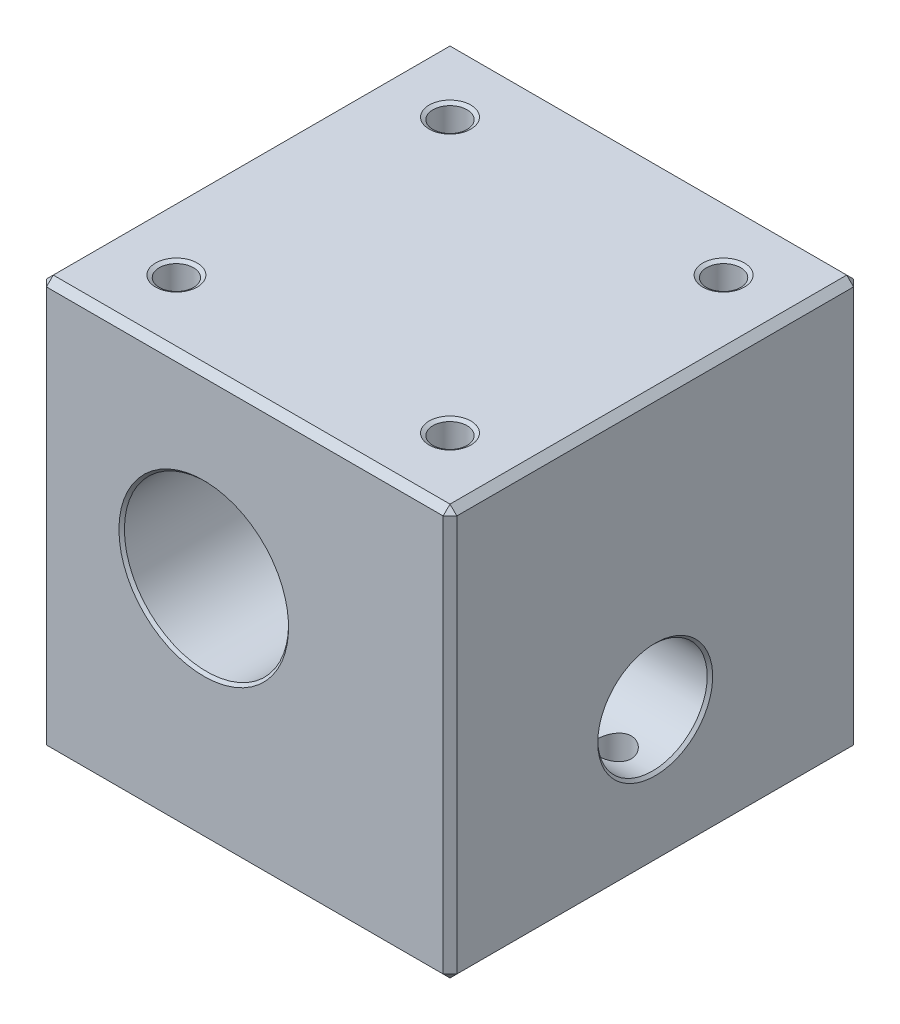
from build123d import *

# Parameters (mm, degrees)
SCHIZZO1_W                      = 30
SCHIZZO1_H                      = 30
SCHIZZO1_R                      = 6
ESTRUSIONE_ESTRUSIONE1_DEPTH    = 30
F_8_0_8_DIAMETER_HOLE1_D        = 8
F_8_0_8_DIAMETER_HOLE1_DEPTH    = 13.5
F_8_0_8_DIAMETER_HOLE1_TIP      = 2.403442476
FORO_FILETTATO_M3_1_AT_2_COUNT  = 2
FORO_FILETTATO_M3_1_AT_2_PITCH  = 20
FORO_FILETTATO_M3_2_D           = 2.5
FORO_FILETTATO_M3_2_DEPTH       = 8.5
FORO_FILETTATO_M3_2_CSINK_D     = 3.05
FORO_FILETTATO_M3_2_CSINK_ANGLE = 120
FORO_FILETTATO_M3_2_TIP         = 0.751075774
CHAMFER1_SIZE                   = 0.5
CHAMFER2_SIZE                   = 0.2


with BuildPart() as part:
    # Schizzo1 → Estrusione-Estrusione1 (new body)
    with BuildSketch(Plane.XY):
        with Locations((15, 15)):
            Rectangle(SCHIZZO1_W, SCHIZZO1_H)
        with Locations((12, 16.8)):
            Circle(SCHIZZO1_R, mode=Mode.SUBTRACT)
    extrude(amount=ESTRUSIONE_ESTRUSIONE1_DEPTH)

    # Ø8.0 (8) Diameter Hole1
    with Locations(Plane(origin=(30, 0, 0), x_dir=(0, 0, -1), z_dir=(1, 0, 0))):
        with Locations((-15, 10)):
            Hole(F_8_0_8_DIAMETER_HOLE1_D / 2, depth=F_8_0_8_DIAMETER_HOLE1_DEPTH)
            with Locations((0, 0, -(F_8_0_8_DIAMETER_HOLE1_DEPTH + F_8_0_8_DIAMETER_HOLE1_TIP / 2))):  # 118° drill point
                Cone(0, F_8_0_8_DIAMETER_HOLE1_D / 2, F_8_0_8_DIAMETER_HOLE1_TIP, mode=Mode.SUBTRACT)

    # Schizzo7 → Foro filettato M3-1 (revolve, cut)
    with BuildSketch(Plane(origin=(5, 30, 25), x_dir=(0, 0, 1), z_dir=(1, 0, 0))):
        Polygon((0, 0), (0, 9.251075774), (1.25, 8.5), (1.25, 0.158771324), (1.525, 0), align=None)
    foro_filettato_m3_1 = revolve(axis=Axis((5, 36.35, 25), (0, -1, 0)), mode=Mode.SUBTRACT)

    # Foro filettato M3-1 at 2: Foro filettato M3-1 ×2
    with Locations(*[(i * FORO_FILETTATO_M3_1_AT_2_PITCH, 0, 0) for i in range(1, FORO_FILETTATO_M3_1_AT_2_COUNT)]):
        add(foro_filettato_m3_1, mode=Mode.SUBTRACT)

    # Specchia1: Foro filettato M3-1 across plane
    add(foro_filettato_m3_1.mirror(Plane.XY.offset(15)), mode=Mode.SUBTRACT)

    # Specchia1 copy 1 sketch → Specchia1 copy 1 (revolve, cut)
    with BuildSketch(Plane(origin=(25, 30, 5), x_dir=(0, 0, -1), z_dir=(1, 0, 0))):
        Polygon((0, 0), (0, -9.251075774), (1.25, -8.5), (1.25, -0.158771324), (1.525, 0), align=None)
    revolve(axis=Axis((25, 36.35, 5), (0, 1, 0)), mode=Mode.SUBTRACT)

    # Foro filettato M3-2
    with Locations(Plane(origin=(0, 0, 0), x_dir=(-1, 0, 0), z_dir=(0, -1, 0))):
        with Locations((-27, -15)):
            CounterSinkHole(FORO_FILETTATO_M3_2_D / 2, FORO_FILETTATO_M3_2_CSINK_D / 2, depth=FORO_FILETTATO_M3_2_DEPTH, counter_sink_angle=FORO_FILETTATO_M3_2_CSINK_ANGLE)
            with Locations((0, 0, -(FORO_FILETTATO_M3_2_DEPTH + FORO_FILETTATO_M3_2_TIP / 2))):  # 118° drill point
                Cone(0, FORO_FILETTATO_M3_2_D / 2, FORO_FILETTATO_M3_2_TIP, mode=Mode.SUBTRACT)

    # Chamfer1
    chamfer1_edges = [part.edges().sort_by_distance(p)[0] for p in [
        (30, 15, 0),
        (15, 0, 0),
        (0, 0, 15),
        (15, 0, 30),
        (30, 0, 15),
        (0, 15, 0),
        (0, 15, 30),
        (30, 15, 30),
        (15, 30, 0),
        (30, 30, 15),
        (0, 30, 15),
        (15, 30, 30),
    ]]
    chamfer(chamfer1_edges, length=CHAMFER1_SIZE)

    # Chamfer2
    chamfer2_edges = [part.edges().sort_by_distance(p)[0] for p in [
        (6, 16.8, 0),
        (6, 16.8, 30),
        (30, 10, 11),
    ]]
    chamfer(chamfer2_edges, length=CHAMFER2_SIZE)


solid = part.part
